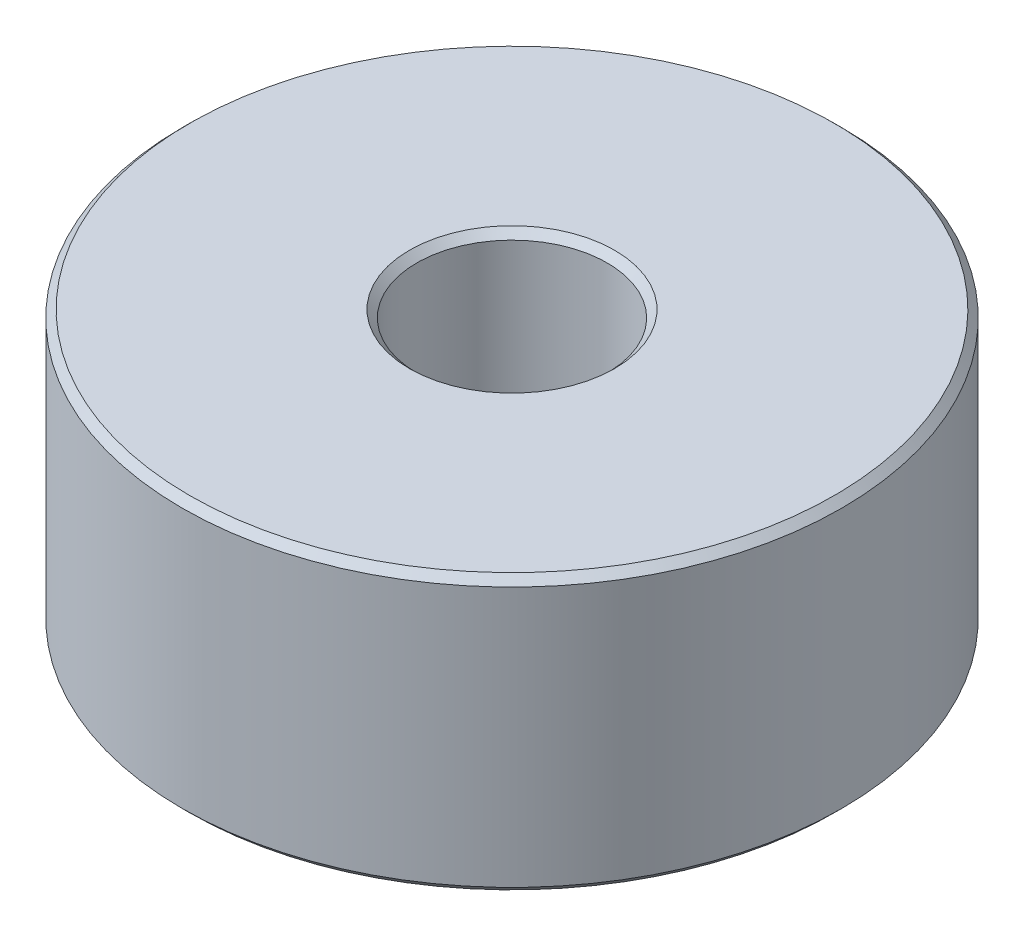
from build123d import *

# Parameters (mm, degrees)
SKETCH1_R           = 9
SKETCH1_R_2         = 2.6
BOSS_EXTRUDE1_DEPTH = 7.5
CHAMFER1_SIZE       = 0.2


with BuildPart() as part:
    # Sketch1 → Boss-Extrude1 (new body)
    with BuildSketch(Plane(origin=(0, 0, 0), x_dir=(1, 0, 0), z_dir=(0, 1, 0))):
        Circle(SKETCH1_R)
        Circle(SKETCH1_R_2, mode=Mode.SUBTRACT)
    extrude(amount=BOSS_EXTRUDE1_DEPTH)

    # Chamfer1
    chamfer1_edges = [part.edges().sort_by_distance(p)[0] for p in [
        (-2.6, 0, 0),
        (-9, 0, 0),
        (-2.6, 7.5, 0),
        (-9, 7.5, 0),
    ]]
    chamfer(chamfer1_edges, length=CHAMFER1_SIZE)


solid = part.part
